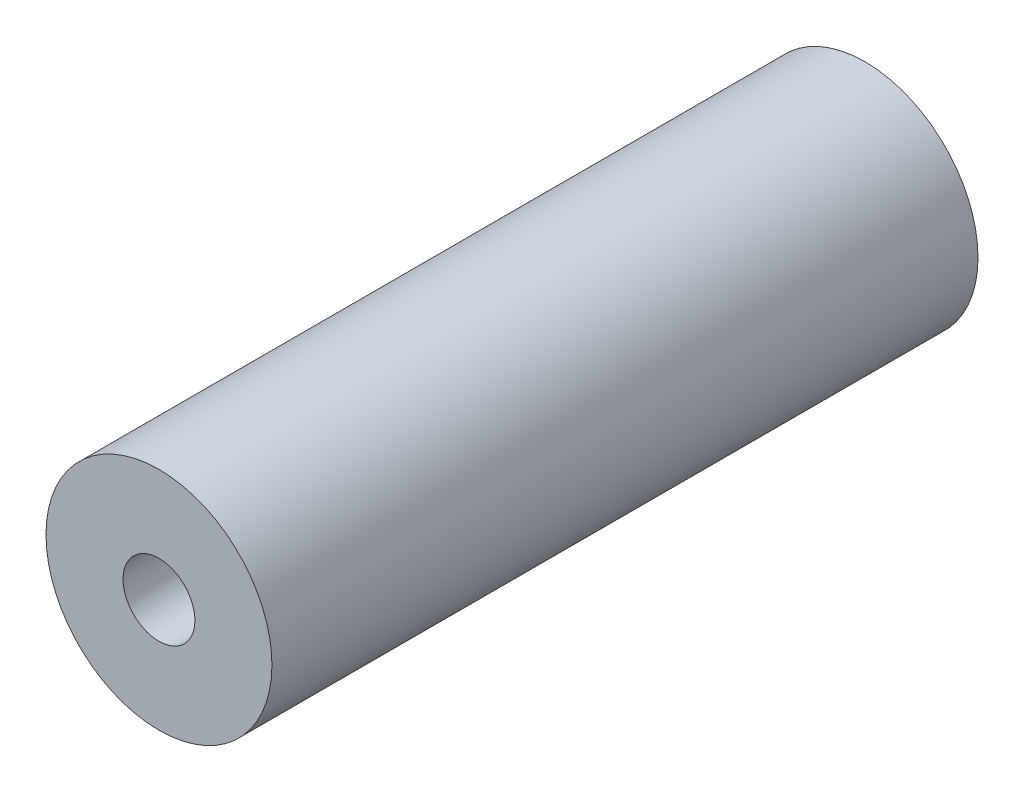
from build123d import *

# Parameters (mm, degrees)
SKETCH1_R           = 6.35
SKETCH1_R_2         = 2.0193
BOSS_EXTRUDE1_DEPTH = 19.84375


with BuildPart() as part:
    # Sketch1 → Boss-Extrude1 (new, symmetric)
    with BuildSketch(Plane.XY):
        Circle(SKETCH1_R)
        Circle(SKETCH1_R_2, mode=Mode.SUBTRACT)
    extrude(amount=BOSS_EXTRUDE1_DEPTH, both=True)


solid = part.part
